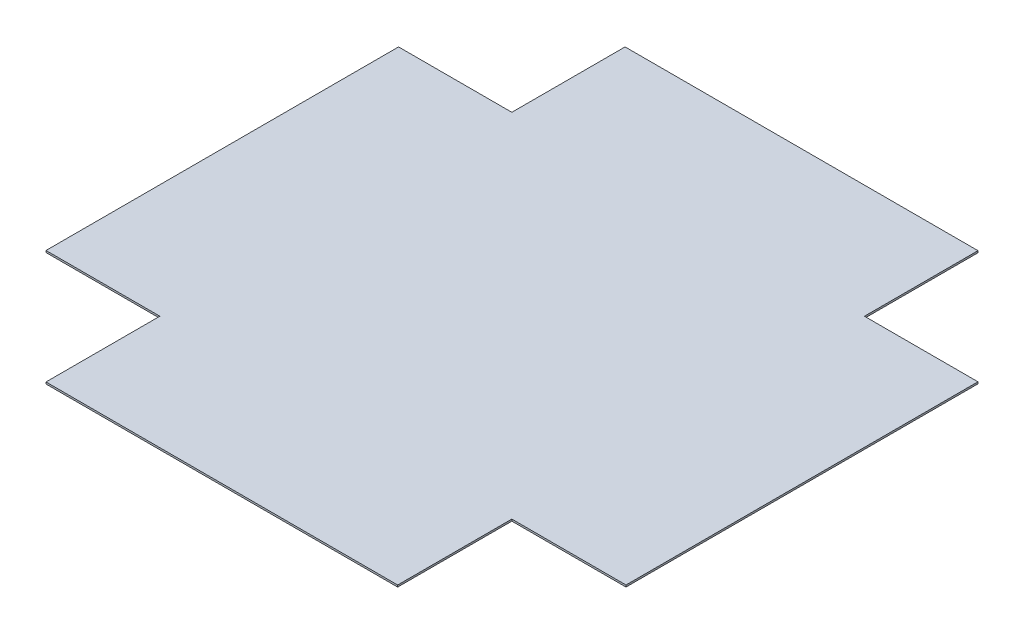
from build123d import *
from OCP.BRepAlgoAPI import BRepAlgoAPI_Cut
from OCP.TopTools import TopTools_ListOfShape

# Parameters (mm, degrees)
SKETCH1_W           = 711.2
SKETCH1_H           = 711.2
BOSS_EXTRUDE1_DEPTH = 2.252762246
SKETCH2_W           = 139.700021816
SKETCH2_H           = 139.700021816
CUT_EXTRUDE2_DEPTH  = 67.238084533
SKETCH3_W           = 140.054303581
SKETCH3_H           = 140.080522497
CUT_EXTRUDE3_DEPTH  = 67.238084533
SKETCH4_W           = 138.94158885
SKETCH4_H           = 138.94158885
CUT_EXTRUDE4_DEPTH  = 67.238084533
SKETCH5_W           = 139.27145682
SKETCH5_H           = 139.336797366
CUT_EXTRUDE5_DEPTH  = 67.238084533


with BuildPart() as part:
    # Sketch1 → Boss-Extrude1 (new body)
    with BuildSketch(Plane(origin=(0, 0, 0), x_dir=(1, 0, 0), z_dir=(0, 1, 0))):
        Rectangle(SKETCH1_W, SKETCH1_H)
    extrude(amount=BOSS_EXTRUDE1_DEPTH)


with BuildPart() as cut_extrude2_tool:
    # Sketch2 → Cut-Extrude2 (new body)
    with BuildSketch(Plane.XZ):
        with Locations((-285.749998801, 285.749986662)):
            Rectangle(SKETCH2_W, SKETCH2_H)
    extrude(amount=-CUT_EXTRUDE2_DEPTH)


with BuildPart() as part_1:
    add(part.part)

    # Cut-Extrude2: cut by cut_extrude2_tool, with a tolerance
    cut_extrude2_stock = TopTools_ListOfShape()
    cut_extrude2_stock.Append(part_1.part.wrapped)
    cut_extrude2_tools = TopTools_ListOfShape()
    cut_extrude2_tools.Append(cut_extrude2_tool.part.wrapped)
    cut_extrude2_cut = BRepAlgoAPI_Cut()
    cut_extrude2_cut.SetArguments(cut_extrude2_stock)
    cut_extrude2_cut.SetTools(cut_extrude2_tools)
    cut_extrude2_cut.SetFuzzyValue(0.00001)
    cut_extrude2_cut.Build()
    add(Compound.cast(cut_extrude2_cut.Shape()).solids(), mode=Mode.REPLACE)

    # Sketch3 → Cut-Extrude3 (cut)
    with BuildSketch(Plane(origin=(0, 2.252762246, 0), x_dir=(1, 0, 0), z_dir=(0, 1, 0))):
        with Locations((285.57284821, -285.559738752)):
            Rectangle(SKETCH3_W, SKETCH3_H)
    extrude(amount=-CUT_EXTRUDE3_DEPTH, mode=Mode.SUBTRACT)

    # Sketch4 → Cut-Extrude4 (cut)
    with BuildSketch(Plane(origin=(0, 2.252762246, 0), x_dir=(1, 0, 0), z_dir=(0, 1, 0))):
        with Locations((-286.129205575, 286.129205575)):
            Rectangle(SKETCH4_W, SKETCH4_H)
    extrude(amount=-CUT_EXTRUDE4_DEPTH, mode=Mode.SUBTRACT)

    # Sketch5 → Cut-Extrude5 (cut)
    with BuildSketch(Plane(origin=(0, 2.252762246, 0), x_dir=(1, 0, 0), z_dir=(0, 1, 0))):
        with Locations((285.96427159, 285.931601317)):
            Rectangle(SKETCH5_W, SKETCH5_H)
    extrude(amount=-CUT_EXTRUDE5_DEPTH, mode=Mode.SUBTRACT)


solid = part_1.part
